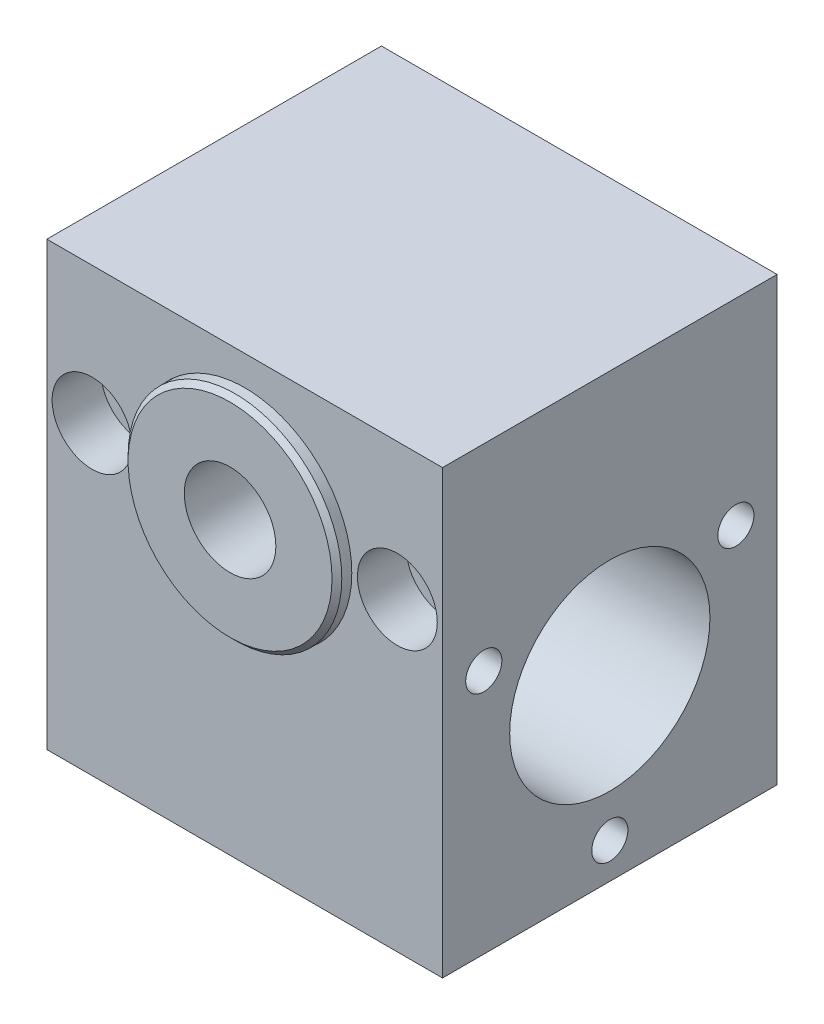
from build123d import *
from build123d.topology import SkipClean

# Parameters (mm, degrees)
BOSS_EXTRUDE1_DEPTH      = 20.574
BOSS_EXTRUDE1_DEPTH_BACK = 20.574
SKETCH1_W                = 34.798
SKETCH1_H                = 45.974
SKETCH1_R                = 10.414
HOLE1_D                  = 3.96748
HOLE1_DEPTH              = 11.5824
HOLE1_CSINK_D            = 4.826
HOLE1_CSINK_ANGLE        = 90
HOLE1_TIP                = 1.145312823
HOLE2_D                  = 3.96748
HOLE2_DEPTH              = 11.5824
HOLE2_CSINK_D            = 4.826
HOLE2_CSINK_ANGLE        = 90
HOLE2_TIP                = 1.145312823
HOLE3_D                  = 9.525
HOLE3_CBORE_D            = 22.2758
HOLE3_CBORE_DEPTH        = 24.638
HOLE4_D                  = 3.7592
HOLE4_DEPTH              = 7.5184
LPATTERN2_COUNT          = 2
LPATTERN2_PITCH          = 26.217009696
LPATTERN2_COUNT_DIR2     = 2
LPATTERN2_PITCH_DIR2     = 25.451525793
HOLE5_D                  = 3.7592
HOLE5_DEPTH              = 7.5184
LPATTERN4_COUNT          = 2
LPATTERN4_PITCH          = 26.217009696
LPATTERN4_COUNT_DIR2     = 2
LPATTERN4_PITCH_DIR2     = 25.451525793


with BuildPart() as part:
    # Sketch1 → Boss-Extrude1 (new, two sides: drawn at the far end of the back side and taken through both)
    with BuildSketch(Plane(origin=(0, 0, 0), x_dir=(0, 0, -1), z_dir=(1, 0, 0)).offset(-BOSS_EXTRUDE1_DEPTH_BACK)):
        with Locations((0, 22.987)):
            Rectangle(SKETCH1_W, SKETCH1_H)
        with Locations((0, 18.542)):
            Circle(SKETCH1_R, mode=Mode.SUBTRACT)
    extrude(amount=BOSS_EXTRUDE1_DEPTH + BOSS_EXTRUDE1_DEPTH_BACK)

    # Sketch2 → Cut-Revolve1 (revolve, cut)
    with BuildSketch(Plane(origin=(15.875, 0, 0), x_dir=(0, 0, -1), z_dir=(1, 0, 0))):
        Polygon((-17.399, 31.75), (-17.399, 35.9029), (-12.319, 35.9029), (-12.319, 34.3296875), (12.319, 34.3296875), (12.319, 35.9029), (17.399, 35.9029), (17.399, 31.75), align=None)
    revolve(axis=Axis((15.875, 31.75, -17.399), (0, 0, 1)), mode=Mode.SUBTRACT)

    # Sketch3 → Cut-Revolve2 (revolve, cut)
    with BuildSketch(Plane(origin=(-15.875, 0, 0), x_dir=(0, 0, -1), z_dir=(1, 0, 0))):
        Polygon((-17.399, 31.75), (-17.399, 35.9029), (-12.319, 35.9029), (-12.319, 34.3296875), (12.319, 34.3296875), (12.319, 35.9029), (17.399, 35.9029), (17.399, 31.75), align=None)
    revolve(axis=Axis((-15.875, 31.75, -17.399), (0, 0, 1)), mode=Mode.SUBTRACT)

    # Hole1
    with Locations(Plane(origin=(0, 0, 0), x_dir=(-1, 0, 0), z_dir=(0, -1, 0))):
        with Locations((0, -12.7)):
            CounterSinkHole(HOLE1_D / 2, HOLE1_CSINK_D / 2, depth=HOLE1_DEPTH, counter_sink_angle=HOLE1_CSINK_ANGLE)
            with Locations((0, 0, -(HOLE1_DEPTH + HOLE1_TIP / 2))):  # 120° drill point
                Cone(0, HOLE1_D / 2, HOLE1_TIP, mode=Mode.SUBTRACT)

    # Hole2
    with Locations(Plane(origin=(0, 0, 0), x_dir=(-1, 0, 0), z_dir=(0, -1, 0))):
        with Locations((0, 12.7)):
            CounterSinkHole(HOLE2_D / 2, HOLE2_CSINK_D / 2, depth=HOLE2_DEPTH, counter_sink_angle=HOLE2_CSINK_ANGLE)
            with Locations((0, 0, -(HOLE2_DEPTH + HOLE2_TIP / 2))):  # 120° drill point
                Cone(0, HOLE2_D / 2, HOLE2_TIP, mode=Mode.SUBTRACT)

    # Hole3 (through all)
    with Locations(Plane.XY.offset(17.399)):
        with Locations((0, 31.75)):
            CounterBoreHole(HOLE3_D / 2, HOLE3_CBORE_D / 2, HOLE3_CBORE_DEPTH)

    # Sketch10 → Revolve1 (revolve)
    with SkipClean():  # the faces are left unmerged after this step: merging them gives an invalid solid
        with BuildSketch(Plane(origin=(0, 0, 0), x_dir=(0, 0, -1), z_dir=(1, 0, 0))):
            Polygon((-18.923, 42.3545), (-18.923, 36.5125), (7.239, 36.5125), (7.239, 42.8625), (-18.415, 42.8625), align=None)
        revolve(axis=Axis((0, 31.75, -7.239), (0, 0, 1)))
    add(part.part.scale(1), mode=Mode.REPLACE)  # the faces are merged on a copy

    # Hole4
    with Locations(Plane(origin=(20.574, 0, 0), x_dir=(0, 0, -1), z_dir=(1, 0, 0))):
        with Locations((13.108504848, 25.511915663)):
            hole4 = Hole(HOLE4_D / 2, depth=HOLE4_DEPTH)

    # LPattern2: Hole4 2 × 2, 1 skipped
    with Locations(*[Vector(0, 0, 1) * (i * LPATTERN2_PITCH) + Vector(0, -0.8571673007021121, 0.5150380749100545) * (j * LPATTERN2_PITCH_DIR2) for i in range(LPATTERN2_COUNT) for j in range(LPATTERN2_COUNT_DIR2) if (i, j) not in ((0, 0), (1, 1))]):
        add(hole4, mode=Mode.SUBTRACT)

    # Hole5
    with Locations(Plane.ZY.offset(20.574)):
        with Locations((-13.108504848, 25.511915663)):
            hole5 = Hole(HOLE5_D / 2, depth=HOLE5_DEPTH)

    # LPattern4: Hole5 2 × 2, 1 skipped
    with Locations(*[Vector(0, 0, 1) * (i * LPATTERN4_PITCH) + Vector(0, -0.8571673007021121, 0.5150380749100545) * (j * LPATTERN4_PITCH_DIR2) for i in range(LPATTERN4_COUNT) for j in range(LPATTERN4_COUNT_DIR2) if (i, j) not in ((0, 0), (1, 1))]):
        add(hole5, mode=Mode.SUBTRACT)


solid = part.part
